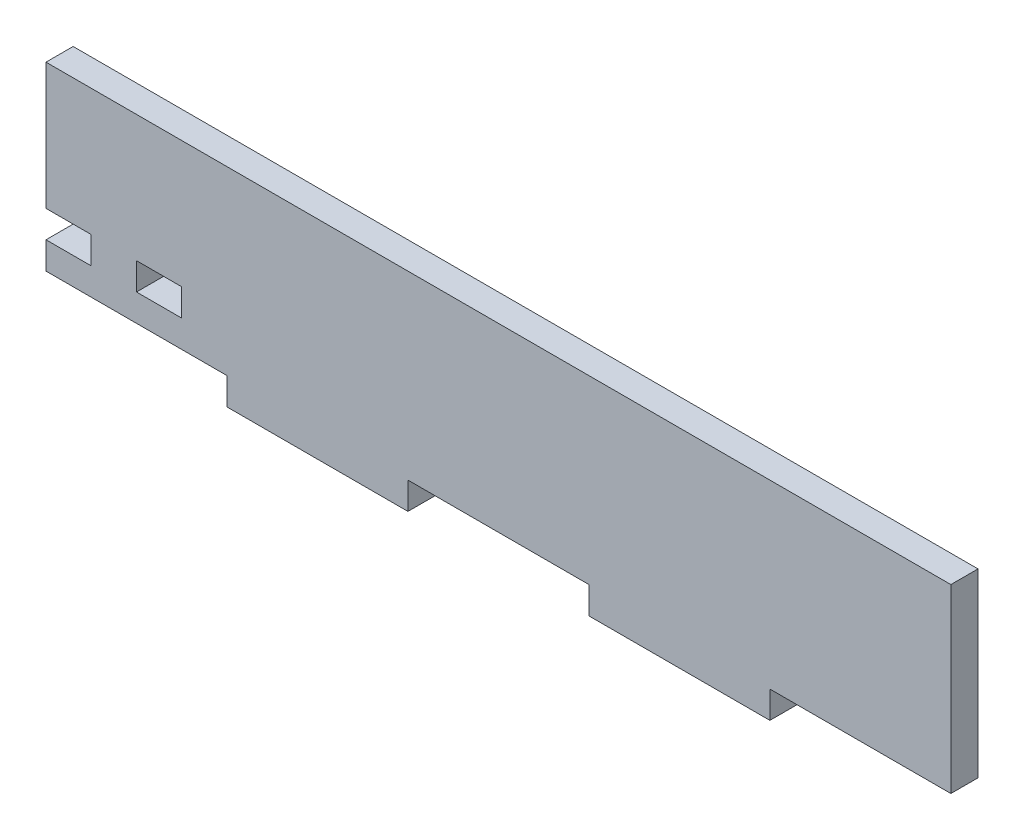
from build123d import *

# Parameters (mm, degrees)
SKETCH1_W           = 200
SKETCH1_H           = 46
BOSS_EXTRUDE1_DEPTH = 6
SKETCH2_W           = 40
SKETCH2_H           = 6
CUT_EXTRUDE1_DEPTH  = 6
SKETCH3_W           = 10
SKETCH3_H           = 6
CUT_EXTRUDE2_DEPTH  = 10


with BuildPart() as part:
    # Sketch1 → Boss-Extrude1 (new body)
    with BuildSketch(Plane.XY):
        Rectangle(SKETCH1_W, SKETCH1_H)
    extrude(amount=BOSS_EXTRUDE1_DEPTH)

    # Sketch2 → Cut-Extrude1 (cut)
    with BuildSketch(Plane.XY.offset(6)):
        with Locations((0, -20)):
            Rectangle(SKETCH2_W, SKETCH2_H)
        with Locations((-80, -20)):
            Rectangle(SKETCH2_W, SKETCH2_H)
        with Locations((80, -20)):
            Rectangle(SKETCH2_W, SKETCH2_H)
    extrude(amount=-CUT_EXTRUDE1_DEPTH, mode=Mode.SUBTRACT)

    # Sketch3 → Cut-Extrude2 (cut)
    with BuildSketch(Plane.XY.offset(6)):
        with Locations((-95, -8)):
            Rectangle(SKETCH3_W, SKETCH3_H)
        with Locations((-75, -8)):
            Rectangle(SKETCH3_W, SKETCH3_H)
    extrude(amount=-CUT_EXTRUDE2_DEPTH, mode=Mode.SUBTRACT)


solid = part.part
